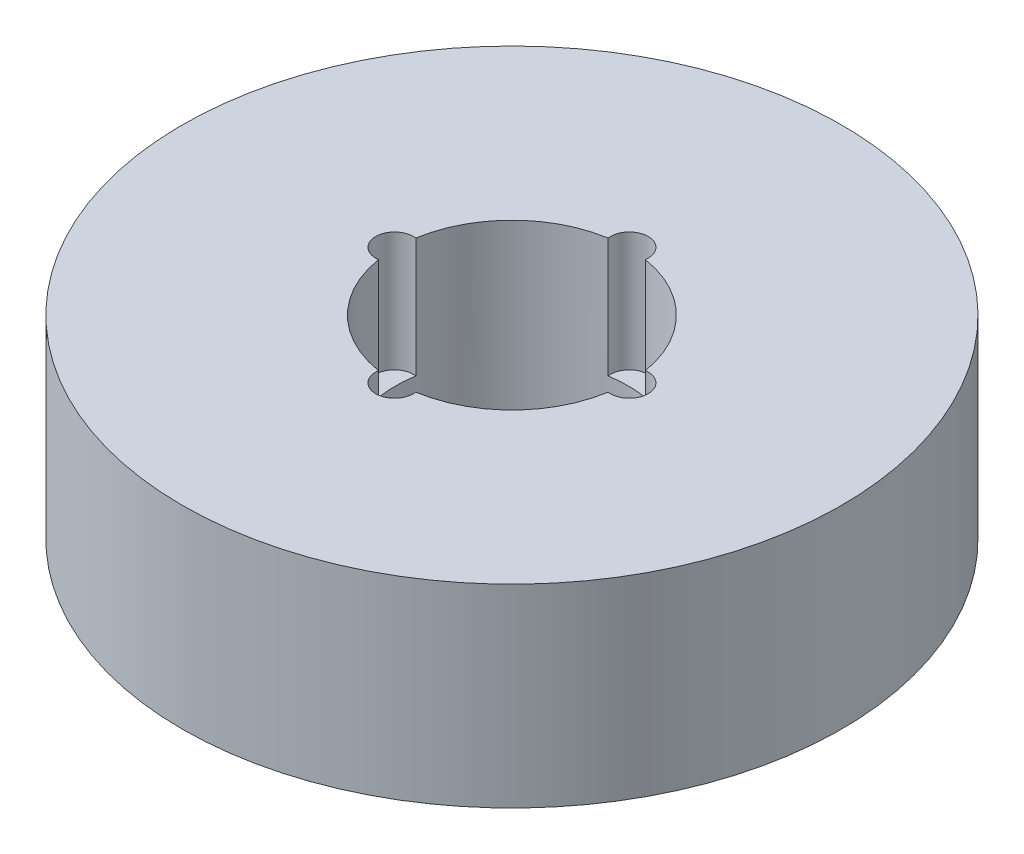
from build123d import *

# Parameters (mm, degrees)
SKETCH1_R           = 42.5
BOSS_EXTRUDE1_DEPTH = 25
SKETCH2_R           = 15
CUT_EXTRUDE1_DEPTH  = 66.096082831
SKETCH3_R           = 2.426893806
CUT_EXTRUDE2_DEPTH  = 15.396178296
CIRPATTERN1_COUNT   = 4


with BuildPart() as part:
    # Sketch1 → Boss-Extrude1 (new body)
    with BuildSketch(Plane(origin=(0, 0, 0), x_dir=(1, 0, 0), z_dir=(0, 1, 0))):
        Circle(SKETCH1_R)
    extrude(amount=BOSS_EXTRUDE1_DEPTH)

    # Sketch2 → Cut-Extrude1 (cut, through all)
    with BuildSketch(Plane(origin=(0, 0, 0), x_dir=(1, 0, 0), z_dir=(0, 1, 0))):
        Circle(SKETCH2_R)
    extrude(amount=CUT_EXTRUDE1_DEPTH, mode=Mode.SUBTRACT)

    # Sketch3 → Cut-Extrude2 (cut)
    with BuildSketch(Plane(origin=(0, 25, 0), x_dir=(1, 0, 0), z_dir=(0, 1, 0))):
        with Locations((-15.140292327, 0)):
            Circle(SKETCH3_R)
    cut_extrude2 = extrude(amount=-CUT_EXTRUDE2_DEPTH, mode=Mode.SUBTRACT)

    # CirPattern1: Cut-Extrude2 ×4 about axis
    cirpattern1_axis = Axis((0, 0, 0), (0, 1, 0))
    for i in range(1, CIRPATTERN1_COUNT):
        add(cut_extrude2.rotate(cirpattern1_axis, i * 360 / CIRPATTERN1_COUNT), mode=Mode.SUBTRACT)


solid = part.part
